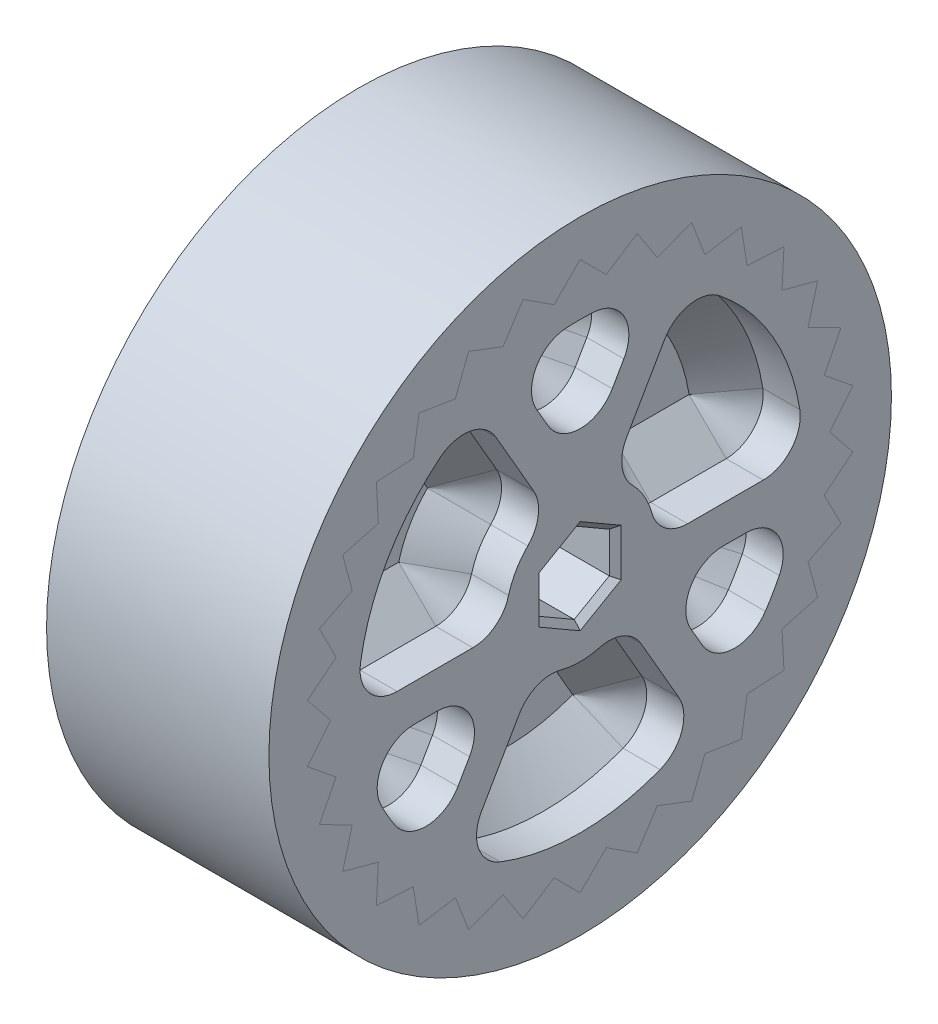
from build123d import *
from build123d.topology import SkipClean

# Parameters (mm, degrees)
SKETCH1_R               = 25.4
BOSS_EXTRUDE2_DEPTH     = 3.175
SKETCH3_R               = 6.35
BOSS_EXTRUDE3_DEPTH     = 9.525
BOSS_EXTRUDE4_REACH     = 42.66
CIRPATTERN5_COUNT       = 3
FILLET1_R               = 3.175
FILLET2_R               = 3.175
CUT_EXTRUDE2_DEPTH      = 41.65983890769865
CUT_EXTRUDE2_DEPTH_BACK = 41.65983890769865
CHAMFER1_SIZE           = 3.175
SHAFTCHAMFER_SIZE       = 0.508
SKETCH8_R               = 26.669999999999998
SKETCH8_R_2             = 12.7
BOSS_EXTRUDE5_DEPTH     = 19.05
CUT_EXTRUDE3_DEPTH      = 43.25494413450336
CIRPATTERN9_COUNT       = 30
CUT_EXTRUDE4_DEPTH      = 43.25494408941988
CUT_EXTRUDE4_DEPTH_BACK = 43.25494408941988
SKETCH10_R              = 26.669999999999998


# Some blends are built 0.0001 mm under size
with BuildPart() as part:
    # Sketch1 → Boss-Extrude2 (new, symmetric)
    with BuildSketch(Plane(origin=(0, 0, 0), x_dir=(0, 0, -1), z_dir=(1, 0, 0))):
        Circle(SKETCH1_R)
    extrude(amount=BOSS_EXTRUDE2_DEPTH, both=True)

    # Sketch3 → Boss-Extrude3 (add, symmetric)
    with BuildSketch(Plane(origin=(0, 0, 0), x_dir=(0, 0, -1), z_dir=(1, 0, 0))):
        Circle(SKETCH3_R)
    extrude(amount=BOSS_EXTRUDE3_DEPTH, both=True)

    # Boss-Extrude4: up to this face of the body (flat: up to its plane)
    boss_extrude4_end = Plane(part.part.faces().sort_by_distance((-9.525, 0, 0))[0])
    # Sketch5 → Boss-Extrude4 (add, up to the picked face)
    with BuildSketch(Plane(origin=(9.525, 0, 0), x_dir=(0, 0, -1), z_dir=(1, 0, 0)), mode=Mode.PRIVATE) as boss_extrude4_sk1:
        with BuildLine():
            Line((-2.54, 5.819871132593916), (-8.903299782514784, 16.84142965970147))
            ThreePointArc((-8.903299782514784, 16.84142965970147), (-14.505014042261495, 12.349375192040972), (-18.045993050535788, 6.102838259368668))
            Line((-18.045993050535788, 6.102838259368668), (-23.94116621038132, 8.484135812614952))
            ThreePointArc((-23.94116621038132, 8.484135812614952), (-19.29769987032471, 16.515410370767952), (-12.079956061561274, 22.343559733192674))
            ThreePointArc((-12.079956061561274, 22.343559733192674), (1.56e-15, 25.400000000000002), (12.079956061561273, 22.343559733192674))
            ThreePointArc((12.079956061561273, 22.343559733192674), (19.227340571827934, 16.59727009284778), (23.868192567962097, 8.687311640471918))
            Line((23.868192567962097, 8.687311640471918), (17.901144425971573, 6.51548373035394))
            ThreePointArc((17.901144425971573, 6.51548373035394), (14.362306470947372, 12.515057044799413), (8.903299782514784, 16.84142965970147))
            Line((8.903299782514784, 16.84142965970147), (2.54, 5.819871132593916))
            Line((2.54, 5.819871132593916), (-2.54, 5.819871132593916))
        make_face()
        with BuildLine():
            Line((-5.960089873328659, 18.09364055965093), (0, 7.770462081368971))
            Line((0, 7.770462081368971), (5.960089873328663, 18.093640559650932))
            ThreePointArc((5.960089873328663, 18.093640559650932), (1.17e-15, 19.050000000000004), (-5.960089873328659, 18.09364055965093))
        make_face(mode=Mode.SUBTRACT)
    boss_extrude4_tool1 = split(extrude(boss_extrude4_sk1.sketch, amount=-BOSS_EXTRUDE4_REACH, mode=Mode.PRIVATE), bisect_by=boss_extrude4_end, keep=Keep.BOTH, mode=Mode.PRIVATE)
    boss_extrude4 = boss_extrude4_tool1.solids().sort_by(Axis((9.525, 11.588968, -5.274231), (-1, 0, 0)))[0]
    add(boss_extrude4)

    # CirPattern5: Boss-Extrude4 ×3 about axis
    with SkipClean():  # the faces are left unmerged after this step: merging them gives an invalid solid
        cirpattern5_axis = Axis((0, -5e-17, 3e-17), (1, 0, 0))
        for i in range(1, CIRPATTERN5_COUNT):
            add(boss_extrude4.rotate(cirpattern5_axis, i * 360 / CIRPATTERN5_COUNT))

    # Fillet1
    # the kernel refuses this fillet: 3.175 mm, written as the material it adds along each edge
    with BuildSketch(Plane(origin=(9.525, -0.7102310406844579, 19.036755812607577), x_dir=(0, -2.38e-15, -1), z_dir=(-1, 0, 0))) as fillet1_piece_1_section:
        with BuildLine():
            CenterArc((3.3542643339810048, -3.175), FILLET1_R, 89.99999999999996, 98.93193584049112)
            ThreePointArc((0.21776603825569132, -3.6679537918630993), (0.02024089159850024, -1.8392395698991024), (0, 0))
            Line((0, 0), (3.354264333981007, 0))
        make_face()
    fillet1_piece_1 = extrude(amount=15.536031197782203, mode=Mode.PRIVATE)
    fillet1_piece_1 = split(fillet1_piece_1, bisect_by=Plane(origin=(-3.175, 0.11590119429228372, 18.292392376393625), z_dir=(1, 0, 0)), keep=Keep.TOP, mode=Mode.PRIVATE)
    add(fillet1_piece_1)
    with BuildSketch(Plane(origin=(9.525, -0.7102310406844823, 6.310156247578044), x_dir=(0, 1.38e-15, 1), z_dir=(-1, 0, 0))) as fillet1_piece_2_section:
        with BuildLine():
            CenterArc((2.8904165050931043, 3.175), FILLET1_R, 194.99699559216134, 75.00300440783866)
            ThreePointArc((-0.17644107913061133, 2.35341034689483), (0.02207235062195231, 1.1849741081832343), (0, 0))
            Line((0, 0), (2.890416505093105, 0))
        make_face()
    fillet1_piece_2 = extrude(amount=13.576041262732764, mode=Mode.PRIVATE)
    fillet1_piece_2 = split(fillet1_piece_2, bisect_by=Plane(origin=(-3.175, -0.1820541246361337, 6.989140739238721), z_dir=(1, 0, 0)), keep=Keep.TOP, mode=Mode.PRIVATE)
    add(fillet1_piece_2)
    with BuildSketch(Plane(origin=(9.525, -5.109640091909432, 3.7701562475780452), x_dir=(0, -0.43385429013787896, -0.900983049190692), z_dir=(-1, 0, 0))) as fillet1_piece_3_section:
        with BuildLine():
            CenterArc((2.950018992331989, 3.1196987863887142), FILLET1_R, 184.2875870351815, 75.00300440783866)
            Line((-0.21609530676800845, 2.8823272526393455), (0, 0))
            ThreePointArc((0, 0), (1.1800075969327894, 0.11060242722256897), (2.3600151938655904, -5e-17))
        make_face()
    fillet1_piece_3 = extrude(amount=13.576041262732764, mode=Mode.PRIVATE)
    fillet1_piece_3 = split(fillet1_piece_3, bisect_by=Plane(origin=(-3.175, -5.961746368487418, 3.652233866417988), z_dir=(1, 0, 0)), keep=Keep.TOP, mode=Mode.PRIVATE)
    add(fillet1_piece_3)
    with BuildSketch(Plane(origin=(9.525, -16.131198619017, 10.133456030092796), x_dir=(0, -0.447795663680597, -0.8941359200864563), z_dir=(-1, 0, 0))) as fillet1_piece_4_section:
        with BuildLine():
            CenterArc((3.368211439186808, -3.1602002979476134), FILLET1_R, 84.46572042198898, 98.93193584049106)
            Line((0.1987922856852959, -3.3483683861500437), (0, 0))
            ThreePointArc((0, 0), (1.837206239556442, 0.08879821231431297), (3.6744124791128843, -5e-17))
        make_face()
    fillet1_piece_4 = extrude(amount=15.536031197782211, mode=Mode.PRIVATE)
    fillet1_piece_4 = split(fillet1_piece_4, bisect_by=Plane(origin=(-3.175, -15.899627091095816, 9.045822809610737), z_dir=(1, 0, 0)), keep=Keep.TOP, mode=Mode.PRIVATE)
    add(fillet1_piece_4)
    with BuildSketch(Plane(origin=(9.525, -3.885231040684464, 18.64959730826653), x_dir=(0, -0.9450213382412374, -0.3270086700207519), z_dir=(-1, 0, 0))) as fillet1_piece_5_section:
        with BuildLine():
            CenterArc((4.449415253717177, -3.1491286068759607), FILLET1_R, 82.68067523582678, 116.40663891770015)
            Line((1.4489725048012276, -4.187381134191788), (0, 0))
            ThreePointArc((0, 0), (2.4269537747548258, 0.1552283587442323), (4.8539075495096515, 2.1e-16))
        make_face()
    fillet1_piece_5 = extrude(amount=18.48476887377413, mode=Mode.PRIVATE)
    fillet1_piece_5 = split(fillet1_piece_5, bisect_by=Plane(origin=(-3.175, -4.983509998192897, 17.329741100134743), z_dir=(1, 0, 0)), keep=Keep.TOP, mode=Mode.PRIVATE)
    add(fillet1_piece_5)
    with BuildSketch(Plane(origin=(9.525, -14.208409518966457, 12.689507434937868), x_dir=(0, 0.8660254037844392, -0.4999999999999991), z_dir=(-1, 0, 0))) as fillet1_piece_6_section:
        with BuildLine():
            CenterArc((4.43099109485172, -3.1750000000000007), FILLET1_R, 89.99999999999999, 116.4066389177014)
            ThreePointArc((1.5872698521687754, -4.587046208136892), (0.6469408147709594, -2.34428412321089), (0, 0))
            Line((0, 0), (4.430991094851721, -3e-17))
        make_face()
    fillet1_piece_6 = extrude(amount=18.48476887377416, mode=Mode.PRIVATE)
    fillet1_piece_6 = split(fillet1_piece_6, bisect_by=Plane(origin=(-3.175, -12.51624103462754, 12.98071680851615), z_dir=(1, 0, 0)), keep=Keep.TOP, mode=Mode.PRIVATE)
    add(fillet1_piece_6)
    with BuildSketch(Plane(origin=(9.525, -3.885231040684484, 6.7294175616092335), x_dir=(0, -0.8660254037844392, 0.4999999999999991), z_dir=(-1, 0, 0))) as fillet1_piece_7_section:
        with BuildLine():
            CenterArc((FILLET1_R * 1.73205080757, FILLET1_R), FILLET1_R, 150.00000000000023, 119.99999999999972)
            Line((FILLET1_R * 0.866025403784, FILLET1_R * 1.5), (0, 0))
            Line((0, 0), (FILLET1_R * 1.73205080757, 9e-17))
        make_face()
    fillet1_piece_7 = extrude(amount=20.098153285077924, mode=Mode.PRIVATE)
    fillet1_piece_7 = split(fillet1_piece_7, bisect_by=Plane(origin=(-3.175, -5.052771317428874, 8.751656640813545), z_dir=(1, 0, 0)), keep=Keep.TOP, mode=Mode.PRIVATE)
    add(fillet1_piece_7)
    with BuildSketch(Plane(origin=(9.525, -16.131198619017013, -10.133456030092784), x_dir=(0, -0.44779566368059587, 0.8941359200864568), z_dir=(-1, 0, 0))) as fillet1_piece_8_section:
        with BuildLine():
            CenterArc((3.3682114391868097, 3.1602002979476143), FILLET1_R, 176.60234373751985, 98.93193584049118)
            Line((0.19879228568529747, 3.348368386150048), (0, 0))
            ThreePointArc((0, 0), (1.8372062395564435, -0.0887982123143144), (3.674412479112885, -1.9e-16))
        make_face()
    fillet1_piece_8 = extrude(amount=15.536031197782213, mode=Mode.PRIVATE)
    fillet1_piece_8 = split(fillet1_piece_8, bisect_by=Plane(origin=(-3.175, -15.899627091095827, -9.045822809610733), z_dir=(1, 0, 0)), keep=Keep.TOP, mode=Mode.PRIVATE)
    add(fillet1_piece_8)
    with BuildSketch(Plane(origin=(9.525, -5.1096400919094345, -3.7701562475780417), x_dir=(0, -0.8660254037844396, -0.4999999999999982), z_dir=(-1, 0, 0))) as fillet1_piece_9_section:
        with BuildLine():
            CenterArc((2.8904165050931026, 3.175), FILLET1_R, 194.9969955921613, 75.00300440783872)
            ThreePointArc((-0.17644107913061302, 2.3534103468948313), (0.02207235062195104, 1.184974108183239), (0, 0))
            Line((0, 0), (2.8904165050931026, -1e-17))
        make_face()
    fillet1_piece_9 = extrude(amount=13.576041262732758, mode=Mode.PRIVATE)
    fillet1_piece_9 = split(fillet1_piece_9, bisect_by=Plane(origin=(-3.175, -5.961746368487417, -3.6522338664179856), z_dir=(1, 0, 0)), keep=Keep.TOP, mode=Mode.PRIVATE)
    add(fillet1_piece_9)
    with BuildSketch(Plane(origin=(9.525, -0.7102310406844873, -6.310156247578044), x_dir=(0, 1.11e-15, -1), z_dir=(-1, 0, 0))) as fillet1_piece_10_section:
        with BuildLine():
            CenterArc((2.8904165050931034, -3.175), FILLET1_R, 90, 75.00300440783866)
            ThreePointArc((-0.17644107913061285, -2.353410346894831), (0.02207235062195199, -1.1849741081832343), (0, 0))
            Line((0, 0), (2.8904165050931034, 0))
        make_face()
    fillet1_piece_10 = extrude(amount=13.57604126273276, mode=Mode.PRIVATE)
    fillet1_piece_10 = split(fillet1_piece_10, bisect_by=Plane(origin=(-3.175, -0.18205412463613493, -6.989140739238719), z_dir=(1, 0, 0)), keep=Keep.TOP, mode=Mode.PRIVATE)
    add(fillet1_piece_10)
    with BuildSketch(Plane(origin=(9.525, -0.7102310406844748, -19.036755812607574), x_dir=(0, 0.9982422530713423, 0.05926553959131868), z_dir=(-1, 0, 0))) as fillet1_piece_11_section:
        with BuildLine():
            CenterArc((3.3682114391868097, -3.1602002979476143), FILLET1_R, 84.46572042198902, 98.93193584049106)
            Line((0.1987922856852979, -3.348368386150046), (0, 0))
            ThreePointArc((0, 0), (1.8372062395564421, 0.08879821231431476), (3.6744124791128843, -1e-17))
        make_face()
    fillet1_piece_11 = extrude(amount=15.536031197782211, mode=Mode.PRIVATE)
    fillet1_piece_11 = split(fillet1_piece_11, bisect_by=Plane(origin=(-3.175, 0.11590119429227418, -18.29239237639363), z_dir=(1, 0, 0)), keep=Keep.TOP, mode=Mode.PRIVATE)
    add(fillet1_piece_11)
    with BuildSketch(Plane(origin=(9.525, -14.208409518966477, -12.689507434937859), x_dir=(0, 0.7557084846163529, -0.6549081510249016), z_dir=(-1, 0, 0))) as fillet1_piece_12_section:
        with BuildLine():
            CenterArc((4.4494152537171825, -3.1491286068759607), FILLET1_R, 82.68067523582683, 116.40663891770015)
            Line((1.448972504801235, -4.187381134191791), (0, 0))
            ThreePointArc((0, 0), (2.426953774754827, 0.15522835874423127), (4.853907549509655, 3e-17))
        make_face()
    fillet1_piece_12 = extrude(amount=18.48476887377414, mode=Mode.PRIVATE)
    fillet1_piece_12 = split(fillet1_piece_12, bisect_by=Plane(origin=(-3.175, -12.516241034627523, -12.980716808516158), z_dir=(1, 0, 0)), keep=Keep.TOP, mode=Mode.PRIVATE)
    add(fillet1_piece_12)
    with BuildSketch(Plane(origin=(9.525, -3.8852310406844826, -18.64959730826652), x_dir=(0, -2e-16, 1), z_dir=(-1, 0, 0))) as fillet1_piece_13_section:
        with BuildLine():
            CenterArc((4.430991094851707, -3.175), FILLET1_R, 89.99999999999994, 116.4066389177014)
            ThreePointArc((1.5872698521687605, -4.587046208136888), (0.6469408147709577, -2.344284123210884), (0, 0))
            Line((0, 0), (4.430991094851709, 0))
        make_face()
    fillet1_piece_13 = extrude(amount=18.484768873774144, mode=Mode.PRIVATE)
    fillet1_piece_13 = split(fillet1_piece_13, bisect_by=Plane(origin=(-3.175, -4.983509998192876, -17.32974110013475), z_dir=(1, 0, 0)), keep=Keep.TOP, mode=Mode.PRIVATE)
    add(fillet1_piece_13)
    with BuildSketch(Plane(origin=(9.525, -3.885231040684489, -6.729417561609231), x_dir=(0, 7.3e-16, -1), z_dir=(-1, 0, 0))) as fillet1_piece_14_section:
        with BuildLine():
            CenterArc((FILLET1_R * 1.73205080757, FILLET1_R), FILLET1_R, 150.00000000000017, 119.9999999999998)
            Line((FILLET1_R * 0.866025403784, FILLET1_R * 1.5), (0, 0))
            Line((0, 0), (FILLET1_R * 1.73205080757, 0))
        make_face()
    fillet1_piece_14 = extrude(amount=20.09815328507792, mode=Mode.PRIVATE)
    fillet1_piece_14 = split(fillet1_piece_14, bisect_by=Plane(origin=(-3.175, -5.05277131742888, -8.75165664081354), z_dir=(1, 0, 0)), keep=Keep.TOP, mode=Mode.PRIVATE)
    add(fillet1_piece_14)
    with BuildSketch(Plane(origin=(9.525, 16.84142965970147, -8.903299782514786), x_dir=(0, -0.8660254037844375, 0.500000000000002), z_dir=(-1, 0, 0))) as fillet1_piece_15_section:
        with BuildLine():
            CenterArc((3.3542643339810083, -3.1749999999999994), FILLET1_R, 89.99999999999994, 98.93193584049118)
            ThreePointArc((0.21776603825569638, -3.667953791863103), (0.02024089159850134, -1.8392395698991046), (0, 0))
            Line((0, 0), (3.3542643339810114, 2e-16))
        make_face()
    fillet1_piece_15 = extrude(amount=15.536031197782213, mode=Mode.PRIVATE)
    fillet1_piece_15 = split(fillet1_piece_15, bisect_by=Plane(origin=(-3.175, 15.783725896803535, -9.24656956678288), z_dir=(1, 0, 0)), keep=Keep.TOP, mode=Mode.PRIVATE)
    add(fillet1_piece_15)
    with BuildSketch(Plane(origin=(9.525, 5.819871132593916, -2.54), x_dir=(0, 0.8660254037844379, -0.500000000000001), z_dir=(-1, 0, 0))) as fillet1_piece_16_section:
        with BuildLine():
            CenterArc((2.890416505093105, 3.1749999999999994), FILLET1_R, 194.99699559216134, 75.00300440783872)
            ThreePointArc((-0.1764410791306104, 2.3534103468948304), (0.02207235062195155, 1.1849741081832337), (0, 0))
            Line((0, 0), (2.890416505093107, 1e-17))
        make_face()
    fillet1_piece_16 = extrude(amount=13.576041262732769, mode=Mode.PRIVATE)
    fillet1_piece_16 = split(fillet1_piece_16, bisect_by=Plane(origin=(-3.175, 6.143800493123549, -3.3369068728207316), z_dir=(1, 0, 0)), keep=Keep.TOP, mode=Mode.PRIVATE)
    add(fillet1_piece_16)
    with BuildSketch(Plane(origin=(9.525, 5.819871132593916, 2.54), x_dir=(0, 0.8660254037844377, 0.5000000000000016), z_dir=(-1, 0, 0))) as fillet1_piece_17_section:
        with BuildLine():
            CenterArc((2.890416505093104, -3.175), FILLET1_R, 90, 75.00300440783869)
            ThreePointArc((-0.17644107913061133, -2.353410346894832), (0.02207235062195223, -1.184974108183234), (0, 0))
            Line((0, 0), (2.8904165050931043, 9e-17))
        make_face()
    fillet1_piece_17 = extrude(amount=13.57604126273276, mode=Mode.PRIVATE)
    fillet1_piece_17 = split(fillet1_piece_17, bisect_by=Plane(origin=(-3.175, 6.143800493123548, 3.336906872820731), z_dir=(1, 0, 0)), keep=Keep.TOP, mode=Mode.PRIVATE)
    add(fillet1_piece_17)
    with BuildSketch(Plane(origin=(9.525, 16.84142965970147, 8.903299782514782), x_dir=(0, -0.5504465893907462, 0.8348703804951373), z_dir=(-1, 0, 0))) as fillet1_piece_18_section:
        with BuildLine():
            CenterArc((3.368211439186808, -3.1602002979476147), FILLET1_R, 84.46572042198903, 98.93193584049112)
            Line((0.19879228568529586, -3.3483683861500495), (0, 0))
            ThreePointArc((0, 0), (1.8372062395564426, 0.08879821231431313), (3.6744124791128816, -1e-17))
        make_face()
    fillet1_piece_18 = extrude(amount=15.536031197782204, mode=Mode.PRIVATE)
    fillet1_piece_18 = split(fillet1_piece_18, bisect_by=Plane(origin=(-3.175, 15.783725896803537, 9.246569566782886), z_dir=(1, 0, 0)), keep=Keep.TOP, mode=Mode.PRIVATE)
    add(fillet1_piece_18)
    with BuildSketch(Plane(origin=(9.525, 18.093640559650936, -5.9600898733286645), x_dir=(0, 0.18931285362488398, 0.9819168210456541), z_dir=(-1, 0, 0))) as fillet1_piece_19_section:
        with BuildLine():
            CenterArc((4.449415253717183, -3.149128606875961), FILLET1_R, 82.6806752358268, 116.4066389177002)
            Line((1.4489725048012343, -4.18738113419179), (0, 0))
            ThreePointArc((0, 0), (2.4269537747548284, 0.1552283587442305), (4.853907549509657, 3e-17))
        make_face()
    fillet1_piece_19 = extrude(amount=18.484768873774144, mode=Mode.PRIVATE)
    fillet1_piece_19 = split(fillet1_piece_19, bisect_by=Plane(origin=(-3.175, 17.499751032820416, -4.349024291618576), z_dir=(1, 0, 0)), keep=Keep.TOP, mode=Mode.PRIVATE)
    add(fillet1_piece_19)
    with BuildSketch(Plane(origin=(9.525, 18.093640559650932, 5.960089873328657), x_dir=(0, -0.8660254037844383, -0.5000000000000006), z_dir=(-1, 0, 0))) as fillet1_piece_20_section:
        with BuildLine():
            CenterArc((4.430991094851704, -3.1749999999999994), FILLET1_R, 89.99999999999997, 116.40663891770134)
            ThreePointArc((1.5872698521687594, -4.5870462081368855), (0.6469408147709614, -2.34428412321088), (0, 0))
            Line((0, 0), (4.430991094851706, 3.2e-16))
        make_face()
    fillet1_piece_20 = extrude(amount=18.484768873774133, mode=Mode.PRIVATE)
    fillet1_piece_20 = split(fillet1_piece_20, bisect_by=Plane(origin=(-3.175, 17.49975103282041, 4.349024291618612), z_dir=(1, 0, 0)), keep=Keep.TOP, mode=Mode.PRIVATE)
    add(fillet1_piece_20)
    with BuildSketch(Plane(origin=(9.525, 7.770462081368971, 0), x_dir=(0, 0.8660254037844378, 0.5000000000000013), z_dir=(-1, 0, 0))) as fillet1_piece_21_section:
        with BuildLine():
            CenterArc((FILLET1_R * 1.73205080757, FILLET1_R), FILLET1_R, 150.0000000000002, 119.9999999999998)
            Line((FILLET1_R * 0.866025403784, FILLET1_R * 1.5), (0, 0))
            Line((0, 0), (FILLET1_R * 1.73205080757, 1.1e-16))
        make_face()
    fillet1_piece_21 = extrude(amount=20.098153285077917, mode=Mode.PRIVATE)
    fillet1_piece_21 = split(fillet1_piece_21, bisect_by=Plane(origin=(-3.175, 10.10554263485775, -1.6e-16), z_dir=(1, 0, 0)), keep=Keep.TOP, mode=Mode.PRIVATE)
    add(fillet1_piece_21)

    # Fillet2
    # the kernel refuses this fillet: 3.175 mm, written as the material it adds along each edge
    with BuildSketch(Plane(origin=(6.011031197782204, -16.131198619017002, 10.133456030092798), x_dir=(0, -0.44779566368059637, -0.8941359200864566), z_dir=(-1, 0, 0))) as fillet2_piece_1:
        with BuildLine():
            CenterArc((3.368211439186808, -3.1602002979476143), FILLET2_R, 84.46572042198905, 98.93193584049112)
            Line((0.19879228568529578, -3.3483683861500486), (0, 0))
            ThreePointArc((0, 0), (1.8372062395564404, 0.08879821231431508), (3.674412479112881, 9e-17))
        make_face()
    extrude(amount=15.536031197782204)
    with BuildSketch(Plane(origin=(8.959768873774157, -3.8852310406844617, 18.649597308266532), x_dir=(0, -1.9e-15, -1), z_dir=(-1, 0, 0))) as fillet2_piece_2:
        with BuildLine():
            CenterArc((4.430991094851721, 3.175), FILLET2_R, 153.5933610822986, 116.40663891770137)
            ThreePointArc((1.5872698521687754, 4.587046208136891), (0.6469408147709617, 2.344284123210886), (0, 0))
            Line((0, 0), (4.43099109485172, 0))
        make_face()
    extrude(amount=18.484768873774158)
    with BuildSketch(Plane(origin=(8.959768873774177, -14.208409518966459, 12.689507434937868), x_dir=(0, 0.8660254037844392, -0.4999999999999993), z_dir=(-1, 0, 0))) as fillet2_piece_3:
        with BuildLine():
            CenterArc((4.430991094851723, -3.1749999999999994), FILLET2_R, 89.99999999999999, 116.40663891770157)
            ThreePointArc((1.5872698521687831, -4.587046208136899), (0.6469408147709629, -2.3442841232108944), (0, 0))
            Line((0, 0), (4.4309910948517235, -5e-17))
        make_face()
    extrude(amount=18.48476887377418)
    with BuildSketch(Plane(origin=(10.573153285077918, -3.8852310406844843, 6.729417561609234), x_dir=(0, 1.78e-15, 1), z_dir=(-1, 0, 0))) as fillet2_piece_4_section:
        with BuildLine():
            CenterArc((FILLET2_R * 1.73205080757, -FILLET2_R), FILLET2_R, 90, 119.99999999999977)
            Line((FILLET2_R * 0.866025403784, -FILLET2_R * 1.5), (0, 0))
            Line((0, 0), (FILLET2_R * 1.73205080757, 0))
        make_face()
    fillet2_piece_4 = extrude(amount=20.09815328507792, mode=Mode.PRIVATE)
    fillet2_piece_4 = split(fillet2_piece_4, bisect_by=Plane(origin=(9.525, -5.053065694261843, 8.752166516444822), z_dir=(-1, 0, 0)), keep=Keep.TOP, mode=Mode.PRIVATE)
    add(fillet2_piece_4)
    with BuildSketch(Plane(origin=(8.95976887377417, -14.208409518966477, -12.689507434937857), x_dir=(0, 0.8660254037844397, 0.4999999999999981), z_dir=(-1, 0, 0))) as fillet2_piece_5:
        with BuildLine():
            CenterArc((4.430991094851724, 3.1750000000000007), FILLET2_R, 153.59336108229851, 116.40663891770151)
            ThreePointArc((1.5872698521687825, 4.587046208136897), (0.6469408147709644, 2.344284123210892), (0, 0))
            Line((0, 0), (4.430991094851725, -1.1e-16))
        make_face()
    extrude(amount=18.48476887377417)
    with BuildSketch(Plane(origin=(8.959768873774143, -3.885231040684479, -18.649597308266525), x_dir=(0, -1e-15, 1), z_dir=(-1, 0, 0))) as fillet2_piece_6:
        with BuildLine():
            CenterArc((4.430991094851718, -3.175), FILLET2_R, 90, 116.40663891770146)
            ThreePointArc((1.587269852168775, -4.5870462081368935), (0.6469408147709631, -2.3442841232108873), (0, 0))
            Line((0, 0), (4.430991094851718, 0))
        make_face()
    extrude(amount=18.484768873774144)
    with BuildSketch(Plane(origin=(10.573153285077918, -3.8852310406844897, -6.729417561609231), x_dir=(0, -0.8660254037844398, -0.49999999999999817), z_dir=(-1, 0, 0))) as fillet2_piece_7_section:
        with BuildLine():
            CenterArc((FILLET2_R * 1.73205080757, -FILLET2_R), FILLET2_R, 90.00000000000003, 119.99999999999977)
            Line((FILLET2_R * 0.866025403784, -FILLET2_R * 1.5), (0, 0))
            Line((0, 0), (FILLET2_R * 1.73205080757, -9e-17))
        make_face()
    fillet2_piece_7 = extrude(amount=20.09815328507792, mode=Mode.PRIVATE)
    fillet2_piece_7 = split(fillet2_piece_7, bisect_by=Plane(origin=(9.525, -5.053065694261852, -8.752166516444817), z_dir=(-1, 0, 0)), keep=Keep.TOP, mode=Mode.PRIVATE)
    add(fillet2_piece_7)
    with BuildSketch(Plane(origin=(6.011031197782204, -0.7102310406844587, 19.036755812607577), x_dir=(0, -1.99e-15, -1), z_dir=(-1, 0, 0))) as fillet2_piece_8:
        with BuildLine():
            CenterArc((3.354264333981008, -3.175), FILLET2_R, 89.99999999999999, 98.93193584049112)
            ThreePointArc((0.21776603825569635, -3.6679537918631), (0.02024089159850096, -1.8392395698991015), (0, 0))
            Line((0, 0), (3.3542643339810088, 0))
        make_face()
    extrude(amount=15.536031197782204)
    with BuildSketch(Plane(origin=(4.0510412627327606, -0.7102310406844835, 6.310156247578044), x_dir=(0, 1.96e-15, 1), z_dir=(-1, 0, 0))) as fillet2_piece_9:
        with BuildLine():
            CenterArc((2.890416505093106, 3.175), FILLET2_R, 194.9969955921613, 75.00300440783866)
            ThreePointArc((-0.17644107913060997, 2.3534103468948313), (0.022072350621953, 1.1849741081832357), (0, 0))
            Line((0, 0), (2.890416505093105, 0))
        make_face()
    extrude(amount=13.576041262732762)
    with BuildSketch(Plane(origin=(4.05104126273276, -5.109640091909432, 3.770156247578046), x_dir=(0, -0.8660254037844395, 0.49999999999999845), z_dir=(-1, 0, 0))) as fillet2_piece_10:
        with BuildLine():
            CenterArc((2.890416505093105, -3.1749999999999994), FILLET2_R, 90.00000000000004, 75.00300440783862)
            ThreePointArc((-0.17644107913061027, -2.353410346894829), (0.02207235062195225, -1.184974108183231), (0, 0))
            Line((0, 0), (2.890416505093103, 1.7e-16))
        make_face()
    extrude(amount=13.57604126273276)
    with BuildSketch(Plane(origin=(6.011031197782211, -16.131198619017013, -10.133456030092786), x_dir=(0, 0.8660254037844398, 0.49999999999999795), z_dir=(-1, 0, 0))) as fillet2_piece_11:
        with BuildLine():
            CenterArc((3.354264333981011, -3.1750000000000007), FILLET2_R, 90.00000000000003, 98.93193584049112)
            ThreePointArc((0.21776603825569932, -3.6679537918631038), (0.02024089159850199, -1.8392395698991029), (0, 0))
            Line((0, 0), (3.35426433398101, -2e-17))
        make_face()
    extrude(amount=15.536031197782211)
    with BuildSketch(Plane(origin=(4.051041262732758, -5.109640091909434, -3.7701562475780426), x_dir=(0, -0.8660254037844398, -0.49999999999999784), z_dir=(-1, 0, 0))) as fillet2_piece_12:
        with BuildLine():
            CenterArc((2.8904165050931043, 3.1749999999999994), FILLET2_R, 194.99699559216128, 75.00300440783872)
            ThreePointArc((-0.17644107913061163, 2.3534103468948326), (0.02207235062195276, 1.184974108183235), (0, 0))
            Line((0, 0), (2.890416505093103, 0))
        make_face()
    extrude(amount=13.576041262732758)
    with BuildSketch(Plane(origin=(4.05104126273276, -0.7102310406844873, -6.310156247578044), x_dir=(0, 1.11e-15, -1), z_dir=(-1, 0, 0))) as fillet2_piece_13:
        with BuildLine():
            CenterArc((2.8904165050931034, -3.175), FILLET2_R, 90, 75.00300440783866)
            ThreePointArc((-0.17644107913061285, -2.353410346894831), (0.02207235062195199, -1.1849741081832343), (0, 0))
            Line((0, 0), (2.8904165050931034, 0))
        make_face()
    extrude(amount=13.57604126273276)
    with BuildSketch(Plane(origin=(6.011031197782211, -0.7102310406844724, -19.036755812607574), x_dir=(0, 0.9982422530713423, 0.059265539591318715), z_dir=(-1, 0, 0))) as fillet2_piece_14:
        with BuildLine():
            CenterArc((3.3682114391868074, -3.1602002979476143), FILLET2_R, 84.46572042198902, 98.93193584049106)
            Line((0.19879228568529558, -3.348368386150046), (0, 0))
            ThreePointArc((0, 0), (1.8372062395564404, 0.08879821231431471), (3.674412479112882, -1e-17))
        make_face()
    extrude(amount=15.536031197782211)
    with BuildSketch(Plane(origin=(6.011031197782206, 16.84142965970147, 8.903299782514782), x_dir=(0, -0.5504465893907462, 0.8348703804951373), z_dir=(-1, 0, 0))) as fillet2_piece_15:
        with BuildLine():
            CenterArc((3.368211439186808, -3.1602002979476147), FILLET2_R, 84.46572042198903, 98.93193584049112)
            Line((0.19879228568529586, -3.3483683861500495), (0, 0))
            ThreePointArc((0, 0), (1.8372062395564426, 0.08879821231431313), (3.6744124791128816, -1e-17))
        make_face()
    extrude(amount=15.536031197782206)
    with BuildSketch(Plane(origin=(8.959768873774166, 18.093640559650936, -5.960089873328665), x_dir=(0, -0.8660254037844379, 0.5000000000000014), z_dir=(-1, 0, 0))) as fillet2_piece_16:
        with BuildLine():
            CenterArc((4.430991094851723, 3.1750000000000003), FILLET2_R, 153.59336108229857, 116.4066389177014)
            ThreePointArc((1.5872698521687771, 4.5870462081368935), (0.6469408147709651, 2.3442841232108895), (0, 0))
            Line((0, 0), (4.430991094851722, -1.1e-16))
        make_face()
    extrude(amount=18.48476887377417)
    with BuildSketch(Plane(origin=(8.959768873774138, 18.09364055965093, 5.96008987332866), x_dir=(0, -0.8660254037844378, -0.5000000000000013), z_dir=(-1, 0, 0))) as fillet2_piece_17:
        with BuildLine():
            CenterArc((4.430991094851713, -3.174999999999999), FILLET2_R, 90, 116.4066389177014)
            ThreePointArc((1.5872698521687703, -4.587046208136888), (0.6469408147709617, -2.3442841232108838), (0, 0))
            Line((0, 0), (4.430991094851713, 2e-16))
        make_face()
    extrude(amount=18.484768873774136)
    with BuildSketch(Plane(origin=(10.573153285077918, 7.77046208136897, 3.4e-16), x_dir=(0, 0.8660254037844378, -0.5000000000000013), z_dir=(-1, 0, 0))) as fillet2_piece_18_section:
        with BuildLine():
            CenterArc((FILLET2_R * 1.73205080757, -FILLET2_R), FILLET2_R, 89.99999999999999, 119.99999999999983)
            Line((FILLET2_R * 0.866025403784, -FILLET2_R * 1.5), (0, 0))
            Line((0, 0), (FILLET2_R * 1.73205080757, 2.1e-16))
        make_face()
    fillet2_piece_18 = extrude(amount=20.09815328507792, mode=Mode.PRIVATE)
    fillet2_piece_18 = split(fillet2_piece_18, bisect_by=Plane(origin=(9.525, 10.106131388523687, 1.39e-15), z_dir=(-1, 0, 0)), keep=Keep.TOP, mode=Mode.PRIVATE)
    add(fillet2_piece_18)
    with BuildSketch(Plane(origin=(6.011031197782215, 16.84142965970147, -8.903299782514784), x_dir=(0, -0.8660254037844378, 0.5000000000000016), z_dir=(-1, 0, 0))) as fillet2_piece_19:
        with BuildLine():
            CenterArc((3.354264333981007, -3.1750000000000003), FILLET2_R, 89.99999999999999, 98.93193584049095)
            ThreePointArc((0.2177660382556944, -3.6679537918630927), (0.02024089159849894, -1.8392395698990964), (0, 0))
            Line((0, 0), (3.354264333981008, -1e-16))
        make_face()
    extrude(amount=15.536031197782215)
    with BuildSketch(Plane(origin=(4.051041262732769, 5.819871132593917, -2.539999999999999), x_dir=(0, 0.8660254037844378, -0.5000000000000013), z_dir=(-1, 0, 0))) as fillet2_piece_20:
        with BuildLine():
            CenterArc((2.890416505093106, 3.175), FILLET2_R, 194.9969955921613, 75.00300440783872)
            ThreePointArc((-0.17644107913060997, 2.3534103468948318), (0.02207235062195161, 1.184974108183235), (0, 0))
            Line((0, 0), (2.890416505093107, 1.7e-16))
        make_face()
    extrude(amount=13.576041262732769)
    with BuildSketch(Plane(origin=(4.0510412627327606, 5.819871132593916, 2.54), x_dir=(0, 0.8660254037844377, 0.5000000000000016), z_dir=(-1, 0, 0))) as fillet2_piece_21:
        with BuildLine():
            CenterArc((2.890416505093104, -3.175), FILLET2_R, 90, 75.00300440783869)
            ThreePointArc((-0.17644107913061133, -2.353410346894832), (0.02207235062195223, -1.184974108183234), (0, 0))
            Line((0, 0), (2.8904165050931043, 9e-17))
        make_face()
    extrude(amount=13.576041262732762)

    # Sketch6 → Cut-Extrude2 (cut, two sides: drawn at the far end of the back side and taken through both)
    with BuildSketch(Plane(origin=(9.525, 0, 0), x_dir=(0, 0, -1), z_dir=(1, 0, 0)).offset(-CUT_EXTRUDE2_DEPTH_BACK)):
        Polygon((0, 3.4641016151377566), (-3.0000000000000004, 1.7320508075688774), (-3.0000000000000004, -1.7320508075688774), (-8.4e-16, -3.4641016151377557), (2.9999999999999996, -1.7320508075688774), (3, 1.7320508075688787), align=None)
    extrude(amount=CUT_EXTRUDE2_DEPTH + CUT_EXTRUDE2_DEPTH_BACK, mode=Mode.SUBTRACT)

    # Chamfer1
    chamfer1_edges = [part.edges().sort_by_distance(p)[0] for p in [
        (3.175, 13.394625894469375, 3.2471124914600815),
        (3.175, 19.05000000000001, -1.9962e-13),
        (3.174999999999999, 13.394625894468168, -3.247112491459385),
        (3.175, -9.50939485378441, 9.97653005306902),
        (3.175, -9.524999999999325, 16.497783942093957),
        (3.175, -3.885231040684472, 13.22364254452798),
        (3.175, -3.8852310406844834, -13.223642544529374),
        (3.175, -9.524999999999823, -16.497783942093672),
        (3.174999999999999, -9.509394853783212, -9.976530053068313),
        (3.175, 3.175000000000129, 5.499261314031111),
        (3.175, -0.7102310406844721, 12.441532115649),
        (3.175, 11.129798394493887, 5.605687934035292),
        (3.175, 9.525000000000139, 16.49778394209348),
        (3.175, -0.7102310406844801, -12.441532115648915),
        (3.175, 3.1750000000001286, -5.49926131403111),
        (3.175, 9.525000000000261, -16.49778394209341),
        (3.175, 11.129798394493962, -5.605687934035334),
        (3.175, -6.35, -8.907e-14),
        (3.175, -10.419567353809384, -6.835844181613297),
        (3.175, -10.419567353809407, 6.835844181613319),
        (3.175, -19.05, 5.172e-14),
        (-3.1749999999999994, 13.394625894469376, 3.247112491460082),
        (-3.174999999999999, 19.05000000000001, 1.799e-14),
        (-3.175000000000001, 13.394625894468167, -3.2471124914593843),
        (-3.1749999999999994, -3.8852310406844834, -13.223642544529374),
        (-3.174999999999999, -9.524999999999645, -16.497783942093776),
        (-3.175000000000001, -9.509394853783208, -9.976530053068313),
        (-3.1749999999999994, -9.509394853784412, 9.97653005306902),
        (-3.174999999999999, -9.524999999999526, 16.49778394209384),
        (-3.1749999999999994, -3.885231040684472, 13.22364254452798),
        (-3.1749999999999994, -0.7102310406844801, -12.441532115648915),
        (-3.175, 3.175000000000191, -5.499261314031075),
        (-3.1749999999999994, 11.129798394493962, -5.605687934035334),
        (-3.174999999999999, 9.713741879836018, -16.387364604838695),
        (-3.1749999999999994, -10.419567353809407, 6.835844181613319),
        (-3.175, -6.35, -7.779e-14),
        (-3.1749999999999994, -10.419567353809384, -6.835844181613297),
        (-3.174999999999999, -19.04874498878625, -0.21866493132353762),
        (-3.1749999999999994, 11.129798394493887, 5.605687934035292),
        (-3.175, 3.175000000000192, 5.499261314031074),
        (-3.1749999999999994, -0.7102310406844721, 12.441532115649),
        (-3.174999999999999, 9.335003108950524, 16.60602953616198),
    ]]
    chamfer(chamfer1_edges, length=CHAMFER1_SIZE - 0.0001)  # a hair under: the kernel refuses the full size

    # ShaftChamfer
    shaftchamfer_edges = [part.edges().sort_by_distance(p)[0] for p in [
        (9.525, 2.598076211353316, 1.5000000000000009),
        (9.525, 0, 3),
        (9.525, -2.5980762113533187, 1.5000000000000013),
        (9.525, -2.5980762113533173, -1.4999999999999993),
        (9.525, 8.9e-16, -2.9999999999999996),
        (9.525, 2.598076211353318, -1.4999999999999998),
        (-9.525, 2.598076211353318, -1.5),
        (-9.525, 6.7e-16, -2.9999999999999996),
        (-9.525, -2.5980762113533165, -1.4999999999999996),
        (-9.525000000000002, -2.5980762113533173, 1.5000000000000009),
        (-9.525, 0, 3.0000000000000004),
        (-9.525, 2.598076211353317, 1.5000000000000004),
    ]]
    chamfer(shaftchamfer_edges, length=SHAFTCHAMFER_SIZE)

    # Sketch10 → Cut-Extrude4 (cut, two sides: drawn at the far end of the back side and taken through both)
    with BuildSketch(Plane(origin=(9.525, 0, 0), x_dir=(0, 0, -1), z_dir=(1, 0, 0)).offset(-CUT_EXTRUDE4_DEPTH_BACK)):
        with Locations(Location((0, 0, 0), (0, 0, 180))):
            Circle(SKETCH10_R)
        Polygon((4.884885175763266, 22.981577879240763), (2.2345620700416573, 21.26043792995834), (0, 23.495), (-2.2345620700415303, 21.260437929958467), (-4.884885175762962, 22.981577879240824), (-6.6060251250454085, 20.331254773519245), (-9.55627742906566, 21.463750527313035), (-10.688773182859444, 18.513498223292782), (-13.810014502611425, 19.00785428283956), (-14.304370562158196, 15.886612963087575), (-17.46018767459119, 15.721223596401584), (-17.29479830790519, 12.56540648396859), (-20.34726686191525, 11.747500000000239), (-19.52936037794689, 8.69503144599017), (-22.34507285035456, 7.260354282839624), (-20.910395687204016, 4.444641810431972), (-23.36629193167756, 2.4558962444737564), (-21.37754636571934, 2.1597e-13), (-23.36629193167761, -2.4558962444732875), (-20.9103956872041, -4.444641810431551), (-22.345072850354704, -7.260354282839176), (-19.529360377947075, -8.695031445989772), (-20.347266861915497, -11.747499999999812), (-17.294798307905452, -12.565406483968228), (-17.460187674591516, -15.721223596401227), (-14.304370562158521, -15.886612963087284), (-13.810014502611814, -19.00785428283928), (-10.688773182859816, -18.513498223292565), (-9.556277429066089, -21.46375052731284), (-6.606025125045822, -20.33125477351911), (-4.884885175763423, -22.981577879240728), (-2.2345620700417257, -21.260437929958275), (0, -23.495), (2.234562070041592, -21.260437929958407), (4.884885175763113, -22.981577879240795), (6.606025125045546, -20.331254773519195), (9.5562774290658, -21.463750527312968), (10.688773182859565, -18.513498223292707), (13.810014502611558, -19.00785428283946), (14.304370562158308, -15.886612963087476), (17.460187674591303, -15.721223596401462), (17.294798307905282, -12.56540648396847), (20.347266861915337, -11.747500000000098), (19.529360377946958, -8.695031445990042), (22.345072850354608, -7.260354282839484), (20.91039568720404, -4.444641810431835), (23.366291931677576, -2.4558962444736037), (21.37754636571934, -7.459e-14), (23.366291931677598, 2.455896244473446), (20.910395687204073, 4.444641810431697), (22.345072850354654, 7.260354282839332), (19.529360377947015, 8.69503144598991), (20.34726686191542, 11.747499999999954), (17.294798307905364, 12.56540648396835), (17.46018767459141, 15.721223596401344), (14.304370562158411, 15.886612963087378), (13.810014502611681, 19.007854282839375), (10.688773182859691, 18.51349822329264), (9.556277429065947, 21.4637505273129), (6.6060251250456865, 20.331254773519152), align=None, mode=Mode.SUBTRACT)
    extrude(amount=CUT_EXTRUDE4_DEPTH + CUT_EXTRUDE4_DEPTH_BACK, mode=Mode.SUBTRACT)


with BuildPart() as body_2:
    # Sketch8 → Boss-Extrude5 (new body)
    with BuildSketch(Plane.ZY.offset(9.525)):
        Circle(SKETCH8_R)
        Circle(SKETCH8_R_2, mode=Mode.SUBTRACT)
    extrude(amount=-BOSS_EXTRUDE5_DEPTH)

    # Sketch9 → Cut-Extrude3 (cut, symmetric)
    with BuildSketch(Plane.ZY.offset(9.525)):
        Polygon((-2.5399999999999925, 20.955000000000005), (0, 23.495), (2.5399999999999925, 20.955000000000005), (0, 0), align=None)
    cut_extrude3 = extrude(amount=CUT_EXTRUDE3_DEPTH, both=True, mode=Mode.SUBTRACT)

    # CirPattern9: Cut-Extrude3 ×30 about axis
    cirpattern9_axis = Axis((0, -4.3e-16, -7e-17), (1, 0, 0))
    for i in range(1, CIRPATTERN9_COUNT):
        add(cut_extrude3.rotate(cirpattern9_axis, i * 360 / CIRPATTERN9_COUNT), mode=Mode.SUBTRACT)


solid = Compound([part.part, body_2.part])
